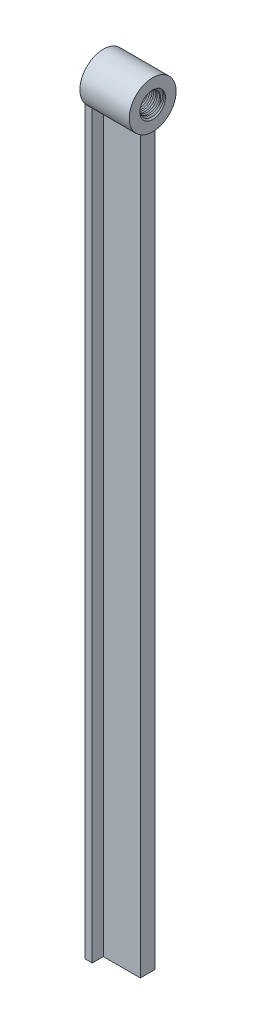
from build123d import *

# Parameters (mm, degrees)
SKETCH1_W                = 15
SKETCH1_H                = 300
BOSS_EXTRUDE1_DEPTH      = 3
SKETCH5_W                = 3
SKETCH5_H                = 300
BOSS_EXTRUDE2_DEPTH      = 7.5
BOSS_EXTRUDE3_DEPTH      = 2
BOSS_EXTRUDE3_DEPTH_BACK = 18
SKETCH7_R                = 9.5
CUT_EXTRUDE1_REACH       = 308.8
SKETCH8_R                = 4.19
CHAMFER1_SIZE            = 1
CUT_SWEEP1_PITCH         = 1.5


with BuildPart() as part:
    # Sketch1 → Boss-Extrude1 (new, symmetric)
    with BuildSketch(Plane.XY):
        with Locations((-7.5, -156)):
            Rectangle(SKETCH1_W, SKETCH1_H)
    extrude(amount=BOSS_EXTRUDE1_DEPTH, both=True)

    # Sketch5 → Boss-Extrude2 (add, symmetric)
    with BuildSketch(Plane.XY):
        with Locations((-16.5, -156)):
            Rectangle(SKETCH5_W, SKETCH5_H)
    extrude(amount=BOSS_EXTRUDE2_DEPTH, both=True)

    # Sketch7 → Boss-Extrude3 (add, two sides: drawn at the far end of the back side and taken through both)
    with BuildSketch(Plane(origin=(0, 0, 0), x_dir=(0, 0, -1), z_dir=(1, 0, 0)).offset(-BOSS_EXTRUDE3_DEPTH_BACK)):
        with Locations(Location((0, 0, 0), (0, 0, 90))):
            Circle(SKETCH7_R)
    extrude(amount=BOSS_EXTRUDE3_DEPTH + BOSS_EXTRUDE3_DEPTH_BACK)

    # Sketch8 → Cut-Extrude1 (cut, up to next)
    with BuildSketch(Plane(origin=(2, 0, 0), x_dir=(0, 0, -1), z_dir=(1, 0, 0)), mode=Mode.PRIVATE) as cut_extrude1_sk1:
        with Locations(Location((0, 0, 0), (0, 0, 90))):
            Circle(SKETCH8_R)
    cut_extrude1_tool1 = extrude(cut_extrude1_sk1.sketch, amount=-CUT_EXTRUDE1_REACH, mode=Mode.PRIVATE) & part.part
    add(cut_extrude1_tool1.solids().sort_by_distance((2, 0, 0))[0], mode=Mode.SUBTRACT)

    # Chamfer1
    chamfer1_edges = [part.edges().sort_by_distance(p)[0] for p in [
        (2, -4.19, 0),
        (-18, -4.19, 0),
    ]]
    chamfer(chamfer1_edges, length=CHAMFER1_SIZE)

    # Cut-Sweep1: the profile of Sketch10 screwed along a right-hand helix of 15 turns, 8 arcs to a turn; built about Z, then put on its axis
    cut_sweep1_z = Axis((0, 0, 0), (0, 0, 1))
    cut_sweep1_corners = [(0, 4.99, 0), (0, 3.79, 0.692820323), (0, 3.79, -0.692820323)]
    with BuildLine(mode=Mode.PRIVATE) as cut_sweep1_profile:
        Line(cut_sweep1_corners[0], cut_sweep1_corners[1])
        Line(cut_sweep1_corners[1], cut_sweep1_corners[2])
        Line(cut_sweep1_corners[2], cut_sweep1_corners[0])
    cut_sweep1_cap = Face(cut_sweep1_profile.wire())
    cut_sweep1_turn_angles = [0, 22.5, 45, 67.5, 90, 112.5, 135, 157.5, 180, 202.5, 225, 247.5, 270, 292.5, 315, 337.5, 360]
    cut_sweep1_turn_weights = [1, 0.9238795325112867, 1, 0.9238795325112867, 1, 0.9238795325112867, 1, 0.9238795325112867, 1, 0.9238795325112867, 1, 0.9238795325112867, 1, 0.9238795325112867, 1, 0.9238795325112867, 1]
    cut_sweep1_turn_rails = [Edge.make_bspline([Vector(p[0], p[1], 0).rotate(cut_sweep1_z, cut_sweep1_turn_angles[k]) / cut_sweep1_turn_weights[k] + Vector(0, 0, p[2] + CUT_SWEEP1_PITCH * cut_sweep1_turn_angles[k] / 360) for k in range(17)], [0, 0, 0, 1, 1, 2, 2, 3, 3, 4, 4, 5, 5, 6, 6, 7, 7, 8, 8, 8], 2, cut_sweep1_turn_weights) for p in cut_sweep1_corners]
    cut_sweep1_turn_sides = [Face.make_surface_from_curves(cut_sweep1_turn_rails[p[0]], cut_sweep1_turn_rails[p[1]]) for p in [(0, 1), (1, 2), (2, 0)]]
    cut_sweep1 = Plane(origin=(2, 0, 0), x_dir=(0, 0, 1), z_dir=(-1, 0, 0)) * Solid(Shell([*[p.moved(Location((0, 0, CUT_SWEEP1_PITCH * i))) for i in range(15) for p in cut_sweep1_turn_sides], cut_sweep1_cap, cut_sweep1_cap.rotate(cut_sweep1_z, 5400).moved(Location((0, 0, CUT_SWEEP1_PITCH * 5400 / 360)))]))
    add(cut_sweep1, mode=Mode.SUBTRACT)


solid = part.part
